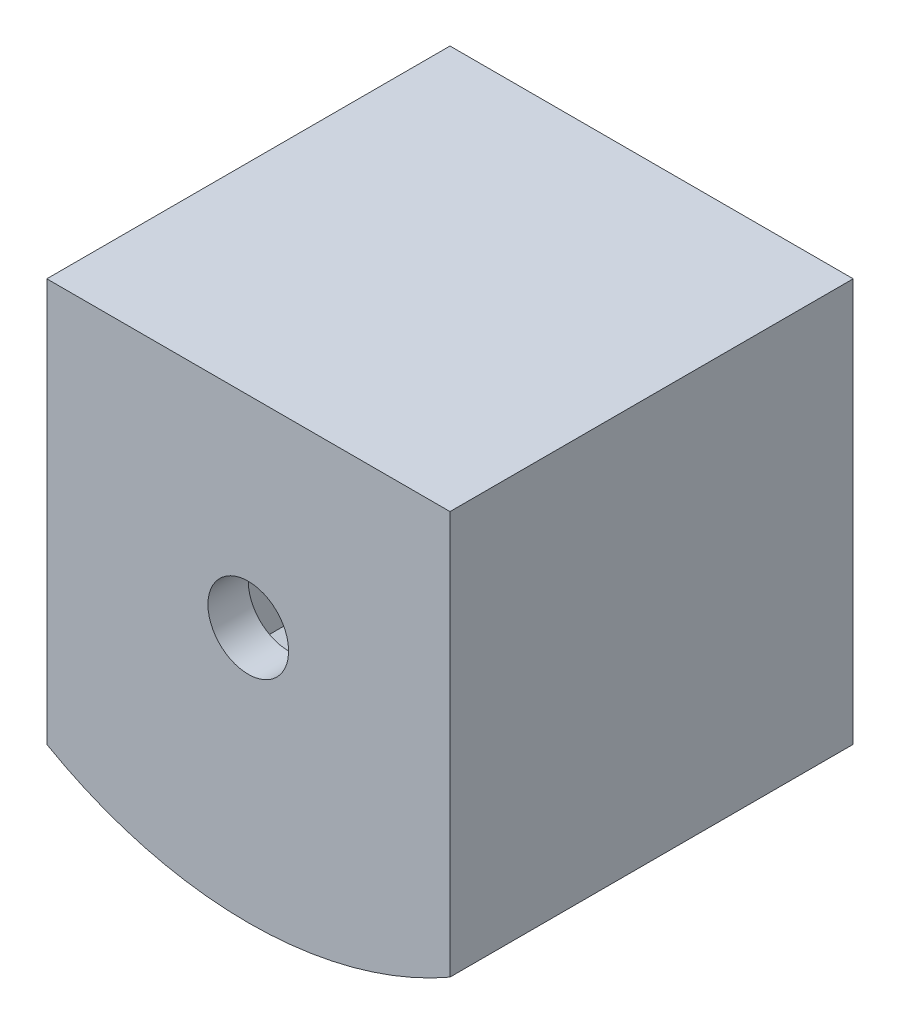
from build123d import *

# Parameters (mm, degrees)
BOSS_EXTRUDE1_DEPTH = 30
SHELL13_T           = -3
SKETCH3_R           = 3
CUT_EXTRUDE2_DEPTH  = 3
SKETCH4_W           = 10
SKETCH4_H           = 1
SKETCH4_W_2         = 1
SKETCH4_H_2         = 10
SKETCH4_W_3         = 7
CUT_EXTRUDE3_DEPTH  = 5


with BuildPart() as part:
    # Sketch1 → Boss-Extrude1 (new body)
    with BuildSketch(Plane.XY):
        with BuildLine():
            Line((15, -15), (15, 15))
            Line((15, 15), (-15, 15))
            Line((-15, 15), (-15, -15))
            ThreePointArc((-15, -15), (0, -19.003831699), (15, -15))
        make_face()
    extrude(amount=BOSS_EXTRUDE1_DEPTH)

    # Shell13
    shell13_openings = [part.faces().sort_by_distance(p)[0] for p in [
        (0, -1.374757535, 0),
    ]]
    offset(amount=SHELL13_T, openings=shell13_openings, kind=Kind.INTERSECTION)

    # Sketch3 → Cut-Extrude2 (cut)
    with BuildSketch(Plane(origin=(0, 0, 27), x_dir=(-1, 0, 0), z_dir=(0, 0, -1))):
        with Locations((0.010259738, 0.007572697)):
            Circle(SKETCH3_R)
    extrude(amount=-CUT_EXTRUDE2_DEPTH, mode=Mode.SUBTRACT)

    # Sketch4 → Cut-Extrude3 (cut)
    with BuildSketch(Plane(origin=(0, 0, 0), x_dir=(-1, 0, 0), z_dir=(0, 0, -1))):
        with Locations((0, 13.5)):
            Rectangle(SKETCH4_W, SKETCH4_H)
        with Locations((-13.5, 0)):
            Rectangle(SKETCH4_W_2, SKETCH4_H_2)
        with Locations((0, -17.5)):
            Rectangle(SKETCH4_W_3, SKETCH4_H)
        with Locations((13.5, 0)):
            Rectangle(SKETCH4_W_2, SKETCH4_H_2)
    extrude(amount=-CUT_EXTRUDE3_DEPTH, mode=Mode.SUBTRACT)


solid = part.part
